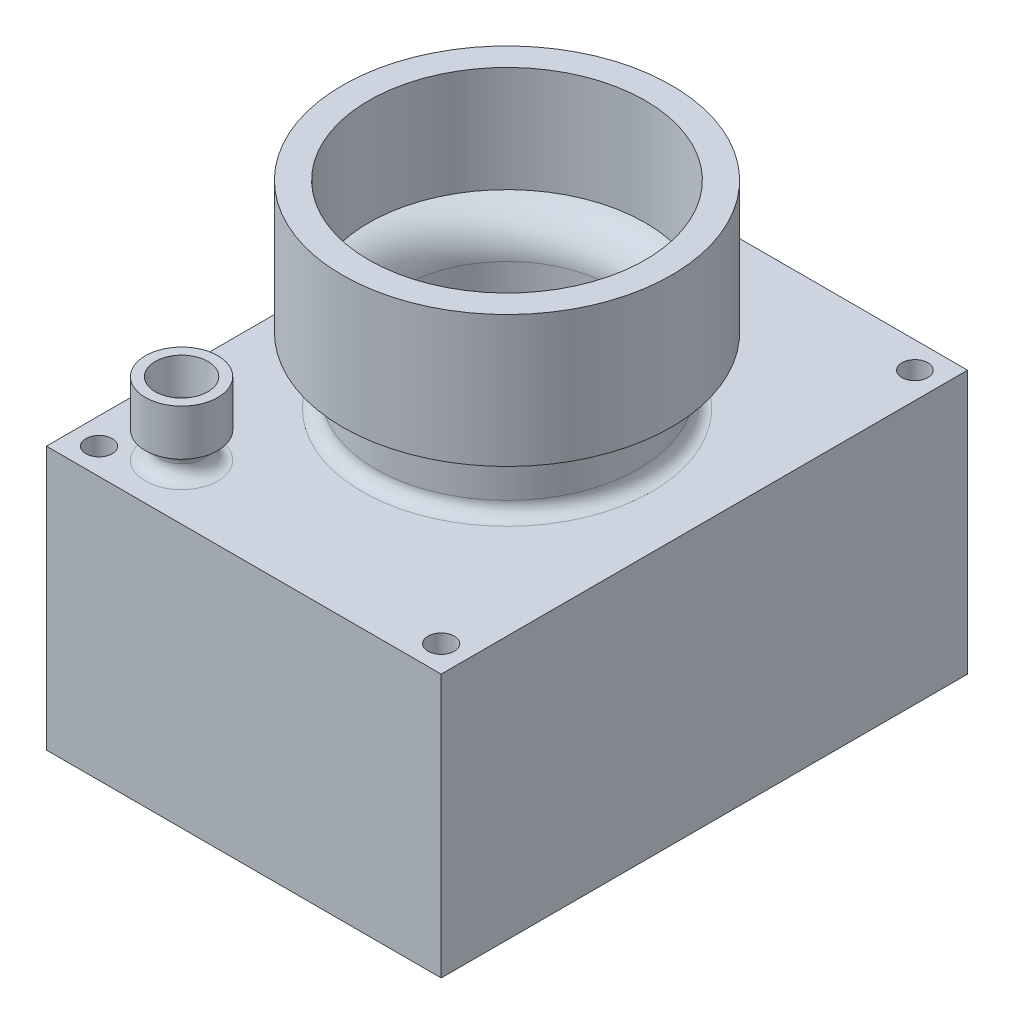
from build123d import *

# Parameters (mm, degrees)
SKETCH1_W           = 76.2
SKETCH1_H           = 101.6
BOSS_EXTRUDE1_DEPTH = 50.8
SKETCH2_R           = 25.4
BOSS_EXTRUDE2_DEPTH = 12.7
SKETCH3_R           = 31.75
BOSS_EXTRUDE3_DEPTH = 25.4
FILLET1_R           = 2.54
FILLET2_R           = 2.54
SHELL1_T            = -5.08
SKETCH4_R           = 2.54
SKETCH4_R_2         = 2.498110056
CUT_EXTRUDE1_DEPTH  = 82.319677815
SKETCH5_R           = 4.445
BOSS_EXTRUDE4_DEPTH = 5.08
SKETCH6_R           = 6.985
BOSS_EXTRUDE5_DEPTH = 8.89
SKETCH7_R           = 5.08
CUT_EXTRUDE2_DEPTH  = 8.89
CUT_EXTRUDE2_DRAFT  = -5
FILLET3_R           = 2.54
FILLET4_R           = 2.54
FILLET5_R           = 2.54


with BuildPart() as part:
    # Sketch1 → Boss-Extrude1 (new body)
    with BuildSketch(Plane(origin=(0, 0, 0), x_dir=(1, 0, 0), z_dir=(0, 1, 0))):
        Rectangle(SKETCH1_W, SKETCH1_H)
    extrude(amount=BOSS_EXTRUDE1_DEPTH)

    # Sketch2 → Boss-Extrude2 (add)
    with BuildSketch(Plane(origin=(0, 50.8, 0), x_dir=(1, 0, 0), z_dir=(0, 1, 0))):
        with Locations(Location((0, 0, 0), (0, 0, 90))):
            Circle(SKETCH2_R)
    extrude(amount=BOSS_EXTRUDE2_DEPTH)

    # Sketch3 → Boss-Extrude3 (add)
    with BuildSketch(Plane(origin=(0, 63.5, 0), x_dir=(1, 0, 0), z_dir=(0, 1, 0))):
        with Locations(Location((0, 0, 0), (0, 0, 270))):
            Circle(SKETCH3_R)
    extrude(amount=BOSS_EXTRUDE3_DEPTH)

    # Fillet1
    fillet1_edges = [part.edges().sort_by_distance(p)[0] for p in [
        (0, 50.8, 25.4),
    ]]
    fillet(fillet1_edges, radius=FILLET1_R)

    # Fillet2
    fillet2_edges = [part.edges().sort_by_distance(p)[0] for p in [
        (0, 63.5, 25.4),
    ]]
    fillet(fillet2_edges, radius=FILLET2_R)

    # Shell1
    shell1_openings = [part.faces().sort_by_distance(p)[0] for p in [
        (0, 88.9, 0),
    ]]
    offset(amount=SHELL1_T, openings=shell1_openings)

    # Sketch4 → Cut-Extrude1 (cut, through all)
    with BuildSketch(Plane(origin=(0, 50.8, 0), x_dir=(1, 0, 0), z_dir=(0, 1, 0))):
        with Locations(Location((-33.02, 45.72, 0), (0, 0, 270))):
            Circle(SKETCH4_R)
        with Locations(Location((33.012804965, 45.72, 0), (0, 0, 270))):
            Circle(SKETCH4_R_2)
        with Locations(Location((-33.02, -45.72, 0), (0, 0, 270))):
            Circle(SKETCH4_R)
        with Locations(Location((33.012804965, -45.72, 0), (0, 0, 270))):
            Circle(SKETCH4_R)
    extrude(amount=-CUT_EXTRUDE1_DEPTH, mode=Mode.SUBTRACT)

    # Sketch5 → Boss-Extrude4 (add)
    with BuildSketch(Plane(origin=(0, 50.8, 0), x_dir=(1, 0, 0), z_dir=(0, 1, 0))):
        with Locations(Location((-22.7138733, -40.09342787, 0), (0, 0, 90))):
            Circle(SKETCH5_R)
    extrude(amount=BOSS_EXTRUDE4_DEPTH)

    # Sketch6 → Boss-Extrude5 (add)
    with BuildSketch(Plane(origin=(0, 55.88, 0), x_dir=(1, 0, 0), z_dir=(0, 1, 0))):
        with Locations(Location((-22.7138733, -40.09342787, 0), (0, 0, 270))):
            Circle(SKETCH6_R)
    extrude(amount=BOSS_EXTRUDE5_DEPTH)


with BuildPart() as cut_extrude2_tool:
    # Sketch7 → Cut-Extrude2 (with draft: the straight prism first)
    with BuildSketch(Plane(origin=(0, 64.77, 0), x_dir=(1, 0, 0), z_dir=(0, 1, 0))):
        with Locations((-22.7138733, -40.09342787)):
            Circle(SKETCH7_R)
    extrude(amount=-CUT_EXTRUDE2_DEPTH)
    # Cut-Extrude2: the draft: its side faces are tilted about the plane it starts from
    cut_extrude2_sides = [cut_extrude2_tool.faces().sort_by_distance(p)[0] for p in [
        (-27.7938733, 60.325, 40.09342787),
    ]]
    draft(cut_extrude2_sides, Plane(origin=(0, 64.77, 0), x_dir=(1, 0, 0), z_dir=(0, 1, 0)), CUT_EXTRUDE2_DRAFT)


with BuildPart() as part_1:
    add(part.part)

    # Cut-Extrude2: cut by cut_extrude2_tool
    add(cut_extrude2_tool.part, mode=Mode.SUBTRACT)

    # Fillet3
    fillet3_edges = [part_1.edges().sort_by_distance(p)[0] for p in [
        (-22.7138733, 50.8, 44.53842787),
    ]]
    fillet(fillet3_edges, radius=FILLET3_R)

    # Fillet4
    fillet4_edges = [part_1.edges().sort_by_distance(p)[0] for p in [
        (-22.7138733, 55.88, 44.53842787),
    ]]
    fillet(fillet4_edges, radius=FILLET4_R - 0.0001)  # a hair under: the kernel refuses the full size

    # Fillet5
    fillet5_edges = [part_1.edges().sort_by_distance(p)[0] for p in [
        (-27.016099081, 55.88, 40.09342787),
    ]]
    fillet(fillet5_edges, radius=FILLET5_R)


solid = part_1.part
